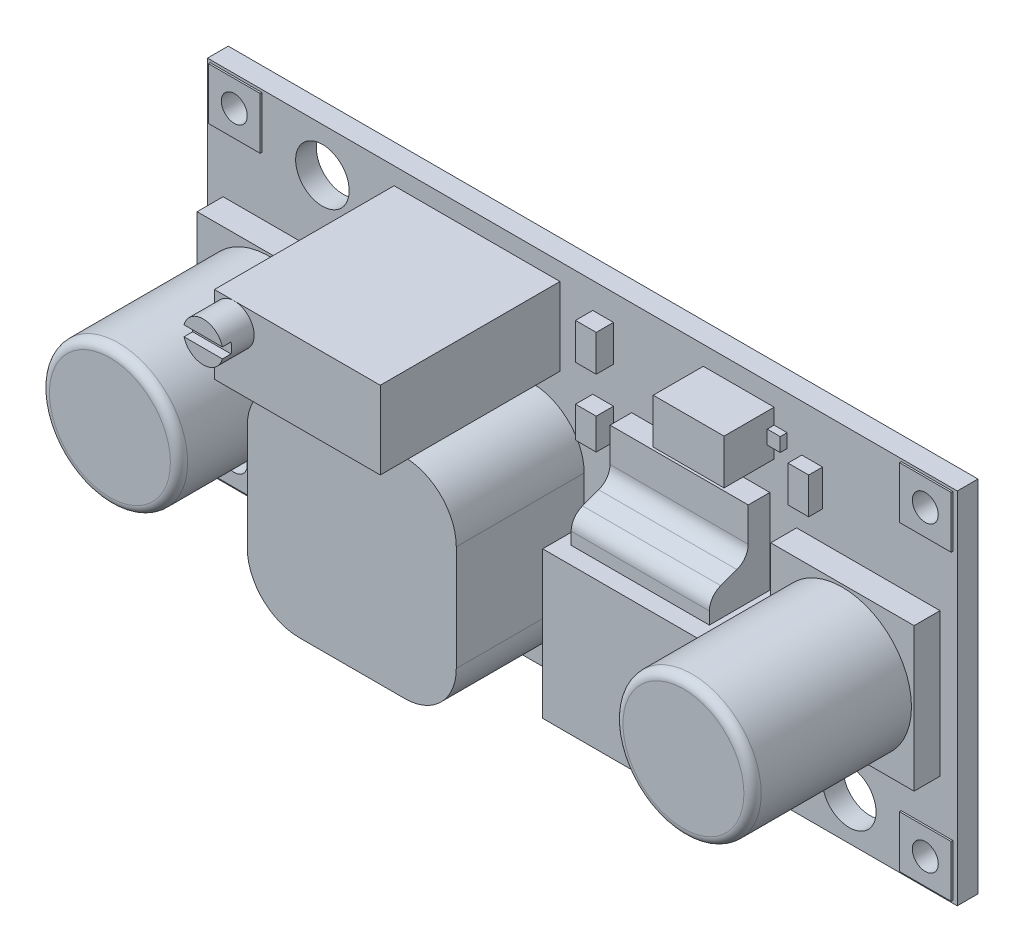
from build123d import *

# Parameters (mm, degrees)
SKICA1_W                      = 43.4
SKICA1_H                      = 20.8
SKICA1_R                      = 1.55
P_IDAT_VYSUNUT_M1_DEPTH       = 1.2
SKICA3_W                      = 12.1
SKICA3_H                      = 12.1
P_IDAT_VYSUNUT_M2_DEPTH       = 7.4
ZAOBLIT1_R                    = 3
SKICA4_W                      = 9.6
SKICA4_H                      = 4.5
P_IDAT_VYSUNUT_M3_DEPTH       = 10.4
SKICA5_R                      = 1.15
P_IDAT_VYSUNUT_M4_DEPTH       = 1.8
SKICA6_W                      = 8.3
SKICA6_H                      = 8.3
SKICA6_R                      = 4
P_IDAT_VYSUNUT_M5_DEPTH       = 1.5
SKICA6_2_R                    = 4
P_IDAT_VYSUNUT_M6_DEPTH       = 10.7
ZAOBLIT2_R                    = 0.5
SKICA7_W                      = 9.3
SKICA7_H                      = 8.5
P_IDAT_VYSUNUT_M7_DEPTH       = 4.5
SKICA7_3_W                    = 9.3
SKICA7_3_H                    = 1.3
P_IDAT_VYSUNUT_M8_DEPTH       = 1.4
SKICA7_4_W                    = 8
SKICA7_4_H                    = 3.4
P_IDAT_VYSUNUT_M9_DEPTH       = 1.25
SKICA7_5_W                    = 8
SKICA7_5_H                    = 1.5
P_IDAT_VYSUNUT_M10_DEPTH      = 3.5
ZKOSEN_1_SIZE                 = 2
ZKOSEN_1_SIZE2                = 0.727940469
ZAOBLIT3_R                    = 1
ZAOBLIT4_R                    = 1
ZAOBLIT5_R                    = 1
SKICA8_W                      = 5.6
SKICA8_H                      = 0.8
P_IDAT_VYSUNUT_M11_DEPTH      = 0.4
SKICA8_3_W                    = 4.1
SKICA8_3_H                    = 2.6
P_IDAT_VYSUNUT_M12_DEPTH      = 2.9
SKICA9_W                      = 1.2
SKICA9_H                      = 1.8
SKICA9_H_2                    = 2.1
P_IDAT_VYSUNUT_M13_DEPTH      = 1
SKICA10_W                     = 1.2
SKICA10_H                     = 2.1
P_IDAT_VYSUNUT_M14_DEPTH      = 0.8
P_IDAT_VYSUNUT_M15_DEPTH      = 0.1
P_IDAT_VYSUNUT_M15_DEPTH_BACK = 1.3
SKICA11_W                     = 3
SKICA11_H                     = 3
SKICA11_R                     = 0.75
SKICA11_2_R                   = 0.75
ODEBRAT_VYSUNUT_M1_DEPTH      = 27.979436614
SKICA12_W                     = 3.658871704
SKICA12_H                     = 0.6
ODEBRAT_VYSUNUT_M2_DEPTH      = 0.5
SKICA13_W                     = 1.5
SKICA13_H                     = 1.5
P_IDAT_VYSUNUT_M16_DEPTH      = 1.1


with BuildPart() as part:
    # Skica1 → Přidat vysunutím1 (new body)
    with BuildSketch(Plane.XY):
        Rectangle(SKICA1_W, SKICA1_H)
        with Locations((-15.05, 7.85)):
            Circle(SKICA1_R, mode=Mode.SUBTRACT)
        with Locations((15.45, -8.05)):
            Circle(SKICA1_R, mode=Mode.SUBTRACT)
    extrude(amount=P_IDAT_VYSUNUT_M1_DEPTH)

    # Skica3 → Přidat vysunutím2 (add)
    with BuildSketch(Plane.XY.offset(1.2)):
        with Locations((-5.95, -2.55)):
            Rectangle(SKICA3_W, SKICA3_H)
    extrude(amount=P_IDAT_VYSUNUT_M2_DEPTH)

    # Zaoblit1
    zaoblit1_edges = [part.edges().sort_by_distance(p)[0] for p in [
        (0.1, -8.6, 4.9),
        (0.1, 3.5, 4.9),
        (-12, 3.5, 4.9),
        (-12, -8.6, 4.9),
    ]]
    fillet(zaoblit1_edges, radius=ZAOBLIT1_R)

    # Skica4 → Přidat vysunutím3 (add)
    with BuildSketch(Plane.XY.offset(1.2)):
        with Locations((-6.1, 7.15)):
            Rectangle(SKICA4_W, SKICA4_H)
    extrude(amount=P_IDAT_VYSUNUT_M3_DEPTH)

    # Skica5 → Přidat vysunutím4 (add)
    with BuildSketch(Plane.XY.offset(11.6)):
        with Locations(Location((-9.75, 8.25, 0), (0, 0, 180))):
            Circle(SKICA5_R)
    extrude(amount=P_IDAT_VYSUNUT_M4_DEPTH)

    # Skica6 → Přidat vysunutím5 (add)
    # profile 1 of 2: a face of its own
    with BuildSketch(Plane.XY.offset(1.2)):
        with Locations((-16.65, -0.25)):
            Rectangle(SKICA6_W, SKICA6_H)
        with Locations((-16.65, -0.25)):
            Circle(SKICA6_R, mode=Mode.SUBTRACT)
    # profile 2 of 2: a face of its own
    with BuildSketch(Plane.XY.offset(1.2)):
        with Locations((16.55, -0.25)):
            Rectangle(SKICA6_W, SKICA6_H)
        with Locations((16.55, -0.25)):
            Circle(SKICA6_R, mode=Mode.SUBTRACT)
    extrude(amount=P_IDAT_VYSUNUT_M5_DEPTH)

    # Skica6<2> → Přidat vysunutím6 (add)
    with BuildSketch(Plane.XY.offset(1.2)):
        with Locations((-16.65, -0.25)):
            Circle(SKICA6_2_R)
        with Locations((16.55, -0.25)):
            Circle(SKICA6_2_R)
    extrude(amount=P_IDAT_VYSUNUT_M6_DEPTH)

    # Zaoblit2
    zaoblit2_edges = [part.edges().sort_by_distance(p)[0] for p in [
        (-20.65, -0.25, 11.9),
        (12.55, -0.25, 11.9),
    ]]
    fillet(zaoblit2_edges, radius=ZAOBLIT2_R)

    # Skica7 → Přidat vysunutím7 (add)
    with BuildSketch(Plane.XY.offset(1.2)):
        with Locations((6.85, -4.25)):
            Rectangle(SKICA7_W, SKICA7_H)
    extrude(amount=P_IDAT_VYSUNUT_M7_DEPTH)

    # Skica7<3> → Přidat vysunutím8 (add)
    with BuildSketch(Plane.XY.offset(1.2)):
        with Locations((6.85, -9.15)):
            Rectangle(SKICA7_3_W, SKICA7_3_H)
    extrude(amount=P_IDAT_VYSUNUT_M8_DEPTH)

    # Skica7<4> → Přidat vysunutím9 (add)
    with BuildSketch(Plane.XY.offset(1.2)):
        with Locations((6.85, 3.2)):
            Rectangle(SKICA7_4_W, SKICA7_4_H)
    extrude(amount=P_IDAT_VYSUNUT_M9_DEPTH)

    # Skica7<5> → Přidat vysunutím10 (add)
    with BuildSketch(Plane.XY.offset(1.2)):
        with Locations((6.85, 0.75)):
            Rectangle(SKICA7_5_W, SKICA7_5_H)
    extrude(amount=P_IDAT_VYSUNUT_M10_DEPTH)

    # Zkosení1
    zkosen_1_edges = [part.edges().sort_by_distance(p)[0] for p in [
        (6.85, 1.5, 2.45),
    ]]
    zkosen_1_side = [part.faces().sort_by_distance(p)[0] for p in [
        (6.85, 1.5, 3.575),
    ]]
    chamfer(zkosen_1_edges, length=ZKOSEN_1_SIZE, length2=ZKOSEN_1_SIZE2, reference=zkosen_1_side[0])

    # Zaoblit3
    # the kernel refuses this fillet: 1 mm, written as the material it takes off along each edge
    with BuildSketch(Plane(origin=(12.503594569, 1.5, 4.7), x_dir=(0, 0, -1), z_dir=(-1, 0, 0))) as zaoblit3_piece_1:
        with BuildLine():
            CenterArc((1, 0.661437828), ZAOBLIT3_R, 180, 41.409622109)
            Line((0, 0.661437828), (-0.02, 0.661437828))
            Line((-0.02, 0.661437828), (-0.02, 0))
            Line((-0.02, 0), (0, -0.02))
            ThreePointArc((0, -0.02), (0.125, -0.02), (0.235, -0.013228757))
            Line((0.235, -0.013228757), (0.25, 0))
        make_face()
    extrude(amount=11.307189139, mode=Mode.SUBTRACT)

    # Zaoblit4
    # the kernel refuses this fillet: 1 mm, written as the material it takes off along each edge
    with BuildSketch(Plane(origin=(0.775606123, 1.5, 4.45), x_dir=(0, -0.953531662347256, 0.30129282915675026), z_dir=(1, 0, 0))) as zaoblit4_piece_1:
        with BuildLine():
            CenterArc((0.528464722, 0.953531662), ZAOBLIT4_R, 217.535269991, 70)
            Line((-0.264513729, 0.344281978), (-0.343811574, 0.28335701))
            Line((-0.343811574, 0.28335701), (-0.079297845, -0.060924968))
            Line((-0.079297845, -0.060924968), (-0.040473229, -0.091443522))
            ThreePointArc((-0.040473229, -0.091443522), (0.736154402, -0.134449607), (0.859886834, -0.095353166))
            Line((0.859886834, -0.095353166), (0.829757551, 0))
        make_face()
    extrude(amount=10.074393877, mode=Mode.SUBTRACT)

    # Zaoblit5
    zaoblit5_edges = [part.edges().sort_by_distance(p)[0] for p in [
        (6.85, 2.227940469, 2.45),
    ]]
    fillet(zaoblit5_edges, radius=ZAOBLIT5_R)

    # Skica8 → Přidat vysunutím11 (add)
    with BuildSketch(Plane.XY.offset(1.2)):
        with Locations((9.05, 8)):
            Rectangle(SKICA8_W, SKICA8_H)
    extrude(amount=P_IDAT_VYSUNUT_M11_DEPTH)

    # Skica8<3> → Přidat vysunutím12 (add)
    with BuildSketch(Plane.XY.offset(1.2)):
        with Locations((9.05, 8)):
            Rectangle(SKICA8_3_W, SKICA8_3_H)
    extrude(amount=P_IDAT_VYSUNUT_M12_DEPTH)

    # Skica9 → Přidat vysunutím13 (add)
    with BuildSketch(Plane.XY.offset(1.2)):
        with Locations((1.2, 3.8)):
            Rectangle(SKICA9_W, SKICA9_H)
        with Locations((1.2, 7.85)):
            Rectangle(SKICA9_W, SKICA9_H_2)
    extrude(amount=P_IDAT_VYSUNUT_M13_DEPTH)

    # Skica10 → Přidat vysunutím14 (add)
    with BuildSketch(Plane.XY.offset(1.2)):
        with Locations((13.3, 6.65)):
            Rectangle(SKICA10_W, SKICA10_H)
    extrude(amount=P_IDAT_VYSUNUT_M14_DEPTH)

    # Skica11 → Přidat vysunutím15 (add, two sides: drawn at the far end of the back side and taken through both)
    # profile 1 of 4: a face of its own
    with BuildSketch(Plane.XY.offset(1.2).offset(-P_IDAT_VYSUNUT_M15_DEPTH_BACK)):
        with Locations((19.95, -8.75)):
            Rectangle(SKICA11_W, SKICA11_H)
        with Locations((19.95, -8.75)):
            Circle(SKICA11_R, mode=Mode.SUBTRACT)
    # profile 2 of 4: a face of its own
    with BuildSketch(Plane.XY.offset(1.2).offset(-P_IDAT_VYSUNUT_M15_DEPTH_BACK)):
        with Locations((19.95, 8.75)):
            Rectangle(SKICA11_W, SKICA11_H)
        with Locations((19.95, 8.75)):
            Circle(SKICA11_R, mode=Mode.SUBTRACT)
    # profile 3 of 4: a face of its own
    with BuildSketch(Plane.XY.offset(1.2).offset(-P_IDAT_VYSUNUT_M15_DEPTH_BACK)):
        with Locations((-20.05, -8.75)):
            Rectangle(SKICA11_W, SKICA11_H)
        with Locations((-20.05, -8.75)):
            Circle(SKICA11_R, mode=Mode.SUBTRACT)
    # profile 4 of 4: a face of its own
    with BuildSketch(Plane.XY.offset(1.2).offset(-P_IDAT_VYSUNUT_M15_DEPTH_BACK)):
        with Locations((-20.05, 8.75)):
            Rectangle(SKICA11_W, SKICA11_H)
        with Locations((-20.05, 8.75)):
            Circle(SKICA11_R, mode=Mode.SUBTRACT)
    extrude(amount=P_IDAT_VYSUNUT_M15_DEPTH + P_IDAT_VYSUNUT_M15_DEPTH_BACK)

    # Skica11<2> → Odebrat vysunutím1 (cut, through all)
    with BuildSketch(Plane.XY.offset(1.2)):
        with Locations((-20.05, 8.75)):
            Circle(SKICA11_2_R)
        with Locations((-20.05, -8.75)):
            Circle(SKICA11_2_R)
        with Locations((19.95, 8.75)):
            Circle(SKICA11_2_R)
        with Locations((19.95, -8.75)):
            Circle(SKICA11_2_R)
    extrude(amount=-ODEBRAT_VYSUNUT_M1_DEPTH, mode=Mode.SUBTRACT)

    # Skica12 → Odebrat vysunutím2 (cut)
    with BuildSketch(Plane.XY.offset(13.4)):
        with Locations((-9.75, 8.25)):
            Rectangle(SKICA12_W, SKICA12_H)
    extrude(amount=-ODEBRAT_VYSUNUT_M2_DEPTH, mode=Mode.SUBTRACT)

    # Skica13 → Přidat vysunutím16 (add)
    with BuildSketch(Plane(origin=(0, 0, 0), x_dir=(-1, 0, 0), z_dir=(0, 0, -1))):
        with Locations((3.85, 7.15)):
            Rectangle(SKICA13_W, SKICA13_H)
        with Locations((6.25, 7.15)):
            Rectangle(SKICA13_W, SKICA13_H)
        with Locations((8.65, 7.15)):
            Rectangle(SKICA13_W, SKICA13_H)
    extrude(amount=P_IDAT_VYSUNUT_M16_DEPTH)


solid = part.part
